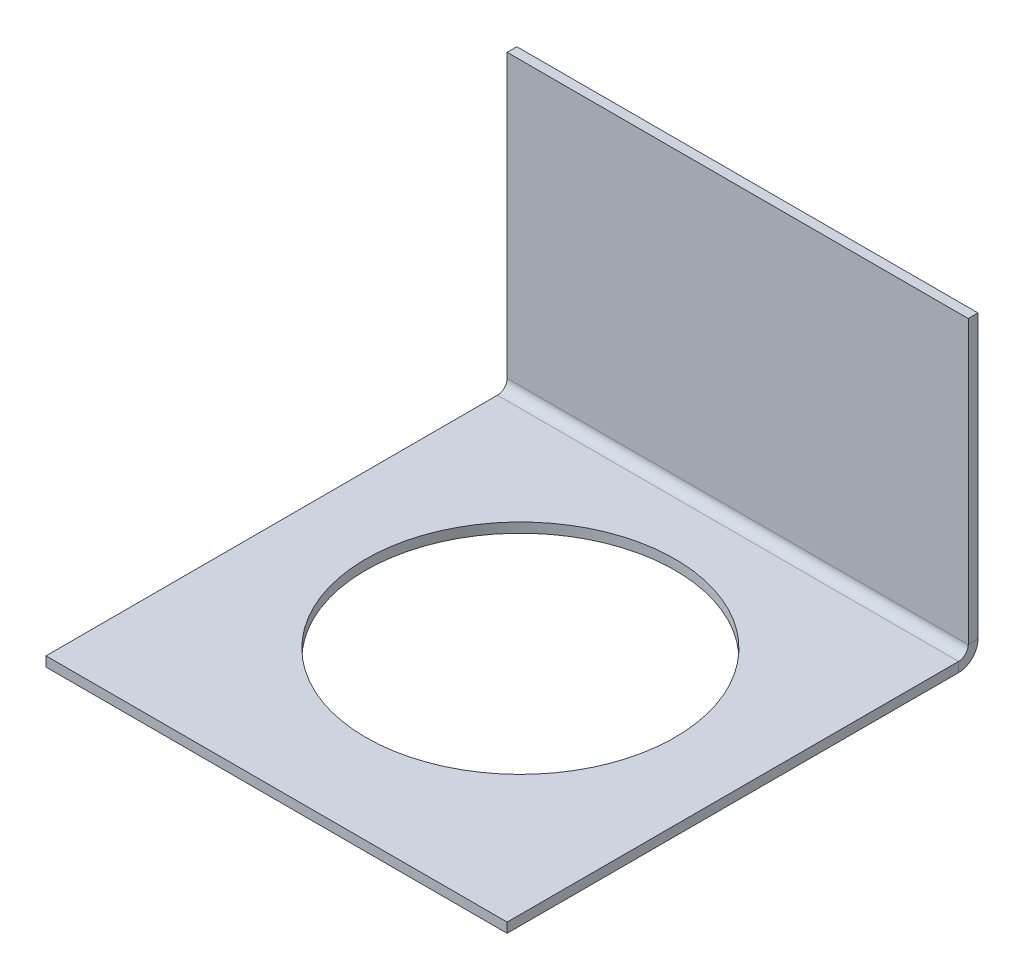
from build123d import *

# Parameters (mm, degrees)
SKETCH10_W                   = 47.36
SKETCH10_H                   = 47.36
BASE_FLANGE1_DEPTH           = 1
EDGE_FLANGE1_STRIP_W         = 6
EDGE_FLANGE1_STRIP_H         = 1
EDGE_FLANGE1_STRIP_CUT_DEPTH = 47.36
EDGE_FLANGE1_DEPTH           = 47.36
SKETCH20_R                   = 15.875
CUT_EXTRUDE1_DEPTH           = 74.388958298


# Sheet-metal steps are written as plain solids
with BuildPart() as part:
    # Sketch10 → Base-Flange1 (new body)
    with BuildSketch(Plane(origin=(0, 0, 0), x_dir=(1, 0, 0), z_dir=(0, 1, 0))):
        with Locations((23.68, -23.68)):
            Rectangle(SKETCH10_W, SKETCH10_H)
    extrude(amount=-BASE_FLANGE1_DEPTH)

    # Edge-Flange1 strip (across the edge) → Edge-Flange1 strip cut (cut)
    with BuildSketch(Plane.ZY.offset(-47.36)):
        with Locations((-2, -0.5)):
            Rectangle(EDGE_FLANGE1_STRIP_W, EDGE_FLANGE1_STRIP_H)
    extrude(amount=EDGE_FLANGE1_STRIP_CUT_DEPTH, mode=Mode.SUBTRACT)

    # Edge-Flange1 section (across the edge) → Edge-Flange1 (add)
    with BuildSketch(Plane.ZY.offset(-47.36)):
        with BuildLine():
            Line((-1, 1), (-1, 30))
            Line((-1, 30), (0, 30))
            Line((0, 30), (0, 1))
            ThreePointArc((0, 1), (0.292893219, 0.292893219), (1, 0))
            Line((1, 0), (1, -1))
            ThreePointArc((1, -1), (-0.414213562, -0.414213562), (-1, 1))
        make_face()
    extrude(amount=EDGE_FLANGE1_DEPTH)

    # Sketch20 → Cut-Extrude1 (cut, through all)
    with BuildSketch(Plane(origin=(0, 0, 0), x_dir=(1, 0, 0), z_dir=(0, 1, 0))):
        with Locations(Location((23.68, -22.32, 0), (0, 0, 270))):
            Circle(SKETCH20_R)
    extrude(amount=-CUT_EXTRUDE1_DEPTH, mode=Mode.SUBTRACT)


solid = part.part
